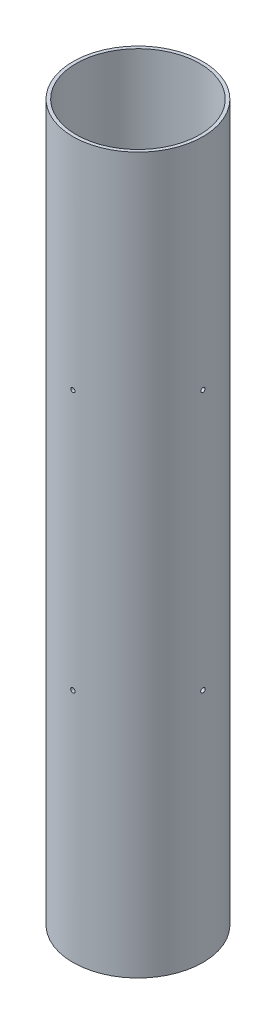
from build123d import *

# Parameters (mm, degrees)
SKETCH1_R                 = 50.8
SKETCH1_R_2               = 48.26
COUPLER_EXTRUSION_DEPTH   = 558.8
BULKHEAD_HOLE_REACH       = 572.229
SKETCH2_R                 = 1.6383
CIRPATTERN1_COUNT         = 4
LOWER_BULKHEAD_HOLE_REACH = 572.229
SKETCH3_R                 = 1.7526
CIRPATTERN2_COUNT         = 4


with BuildPart() as part:
    # Sketch1 → Coupler Extrusion (new body)
    with BuildSketch(Plane(origin=(0, 0, 0), x_dir=(1, 0, 0), z_dir=(0, 1, 0))):
        Circle(SKETCH1_R)
        Circle(SKETCH1_R_2, mode=Mode.SUBTRACT)
    extrude(amount=COUPLER_EXTRUSION_DEPTH)

    # Sketch2 → Bulkhead Hole (cut, up to next)
    with BuildSketch(Plane.XY.offset(50.8), mode=Mode.PRIVATE) as bulkhead_hole_sk1:
        with Locations((0, 387.35)):
            Circle(SKETCH2_R)
    bulkhead_hole_tool1 = extrude(bulkhead_hole_sk1.sketch, amount=-BULKHEAD_HOLE_REACH, mode=Mode.PRIVATE) & part.part
    bulkhead_hole = bulkhead_hole_tool1.solids().sort_by_distance((0, 387.35, 50.8))[0]
    add(bulkhead_hole, mode=Mode.SUBTRACT)

    # CirPattern1: Bulkhead Hole ×4 about axis
    cirpattern1_axis = Axis((0, 558.8, 0), (0, -1, 0))
    for i in range(1, CIRPATTERN1_COUNT):
        add(bulkhead_hole.rotate(cirpattern1_axis, i * 360 / CIRPATTERN1_COUNT), mode=Mode.SUBTRACT)

    # Sketch3 → Lower Bulkhead Hole (cut, up to next)
    with BuildSketch(Plane.XY.offset(50.8), mode=Mode.PRIVATE) as lower_bulkhead_hole_sk1:
        with Locations((0, 184.15)):
            Circle(SKETCH3_R)
    lower_bulkhead_hole_tool1 = extrude(lower_bulkhead_hole_sk1.sketch, amount=-LOWER_BULKHEAD_HOLE_REACH, mode=Mode.PRIVATE) & part.part
    lower_bulkhead_hole = lower_bulkhead_hole_tool1.solids().sort_by_distance((0, 184.15, 50.8))[0]
    add(lower_bulkhead_hole, mode=Mode.SUBTRACT)

    # CirPattern2: Lower Bulkhead Hole ×4 about axis
    cirpattern2_axis = Axis((0, 558.8, 0), (0, -1, 0))
    for i in range(1, CIRPATTERN2_COUNT):
        add(lower_bulkhead_hole.rotate(cirpattern2_axis, i * 360 / CIRPATTERN2_COUNT), mode=Mode.SUBTRACT)


solid = part.part
